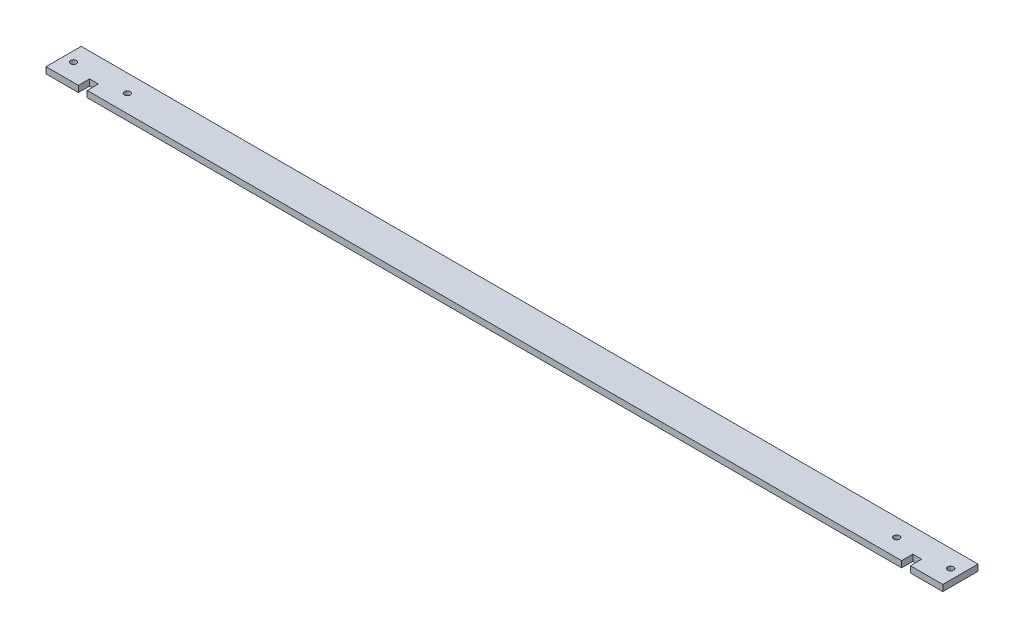
from build123d import *

# Parameters (mm, degrees)
SKETCH1_W           = 914.4
SKETCH1_H           = 35.9
BOSS_EXTRUDE1_DEPTH = 6.4
CUT_EXTRUDE1_DEPTH  = 458.596986987
SKETCH3_R           = 3
CUT_EXTRUDE2_DEPTH  = 458.596986987


with BuildPart() as part:
    # Sketch1 → Boss-Extrude1 (new body)
    with BuildSketch(Plane(origin=(0, 0, 0), x_dir=(1, 0, 0), z_dir=(0, 1, 0))):
        Rectangle(SKETCH1_W, SKETCH1_H)
    extrude(amount=BOSS_EXTRUDE1_DEPTH)

    # Sketch2 → Cut-Extrude1 (cut, symmetric)
    with BuildSketch(Plane(origin=(0, 6.4, 0), x_dir=(1, 0, 0), z_dir=(0, 1, 0))):
        Polygon((-424.2, -1792.21162459), (-424.2, -17.95), (-424.2, -6.55), (-415.2, -6.55), (-415.2, -17.95), (-415.2, -1792.21162459), (-415.2, -5340.734873769), (-424.2, -5340.734873769), align=None)
    cut_extrude1 = extrude(amount=CUT_EXTRUDE1_DEPTH, both=True, mode=Mode.SUBTRACT)

    # Sketch3 → Cut-Extrude2 (cut, through all)
    with BuildSketch(Plane(origin=(0, 6.4, 0), x_dir=(1, 0, 0), z_dir=(0, 1, 0))):
        with Locations((-447.2, 0.05)):
            Circle(SKETCH3_R)
        with Locations((-392.2, 0.05)):
            Circle(SKETCH3_R)
    cut_extrude2 = extrude(amount=-CUT_EXTRUDE2_DEPTH, mode=Mode.SUBTRACT)

    # Mirror1: Cut-Extrude1, Cut-Extrude2 across plane
    add(cut_extrude1.mirror(Plane.ZY), mode=Mode.SUBTRACT)
    add(cut_extrude2.mirror(Plane.ZY), mode=Mode.SUBTRACT)


solid = part.part
